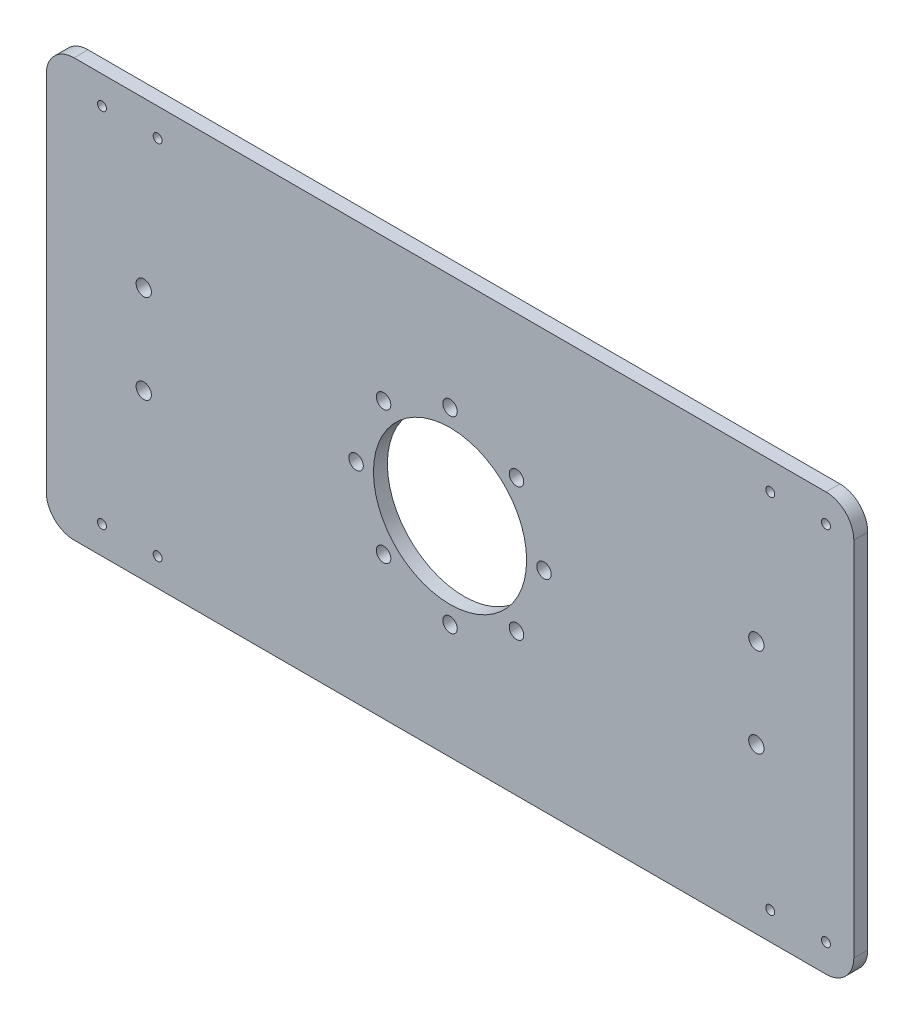
from build123d import *

# Parameters (mm, degrees)
SKETCH_1_W          = 290
SKETCH_1_H          = 150
EXTRUDE_1_DEPTH     = 5
CUT_EXTRUDE_2_REACH = 165.325
SKETCH_5_R          = 27.5
SKETCH_5_R_2        = 2.6
FILLET_1_R          = 10
SKETCH_6_R          = 2.75
CUT_EXTRUDE_3_DEPTH = 10
SKETCH_7_R          = 1.6
CUT_EXTRUDE_4_DEPTH = 10


with BuildPart() as part:
    # 草图1 → 凸台-拉伸1 (new body)
    with BuildSketch(Plane.XY):
        Rectangle(SKETCH_1_W, SKETCH_1_H)
    extrude(amount=EXTRUDE_1_DEPTH)

    # 草图5 → 切除-拉伸2 (cut, up to next)
    with BuildSketch(Plane(origin=(0, 0, 0), x_dir=(-1, 0, 0), z_dir=(0, 0, -1)), mode=Mode.PRIVATE) as cut_extrude_2_sk1:
        Circle(SKETCH_5_R)
    cut_extrude_2_tool1 = extrude(cut_extrude_2_sk1.sketch, amount=-CUT_EXTRUDE_2_REACH, mode=Mode.PRIVATE) & part.part
    # 草图5 → 切除-拉伸2 (cut, up to next)
    with BuildSketch(Plane(origin=(0, 0, 0), x_dir=(-1, 0, 0), z_dir=(0, 0, -1)), mode=Mode.PRIVATE) as cut_extrude_2_sk2:
        with Locations((23.864853865, 23.864853865)):
            Circle(SKETCH_5_R_2)
    cut_extrude_2_tool2 = extrude(cut_extrude_2_sk2.sketch, amount=-CUT_EXTRUDE_2_REACH, mode=Mode.PRIVATE) & part.part
    # 草图5 → 切除-拉伸2 (cut, up to next)
    with BuildSketch(Plane(origin=(0, 0, 0), x_dir=(-1, 0, 0), z_dir=(0, 0, -1)), mode=Mode.PRIVATE) as cut_extrude_2_sk3:
        with Locations((0, 33.75)):
            Circle(SKETCH_5_R_2)
    cut_extrude_2_tool3 = extrude(cut_extrude_2_sk3.sketch, amount=-CUT_EXTRUDE_2_REACH, mode=Mode.PRIVATE) & part.part
    # 草图5 → 切除-拉伸2 (cut, up to next)
    with BuildSketch(Plane(origin=(0, 0, 0), x_dir=(-1, 0, 0), z_dir=(0, 0, -1)), mode=Mode.PRIVATE) as cut_extrude_2_sk4:
        with Locations((-23.864853865, 23.864853865)):
            Circle(SKETCH_5_R_2)
    cut_extrude_2_tool4 = extrude(cut_extrude_2_sk4.sketch, amount=-CUT_EXTRUDE_2_REACH, mode=Mode.PRIVATE) & part.part
    # 草图5 → 切除-拉伸2 (cut, up to next)
    with BuildSketch(Plane(origin=(0, 0, 0), x_dir=(-1, 0, 0), z_dir=(0, 0, -1)), mode=Mode.PRIVATE) as cut_extrude_2_sk5:
        with Locations((-33.75, 0)):
            Circle(SKETCH_5_R_2)
    cut_extrude_2_tool5 = extrude(cut_extrude_2_sk5.sketch, amount=-CUT_EXTRUDE_2_REACH, mode=Mode.PRIVATE) & part.part
    # 草图5 → 切除-拉伸2 (cut, up to next)
    with BuildSketch(Plane(origin=(0, 0, 0), x_dir=(-1, 0, 0), z_dir=(0, 0, -1)), mode=Mode.PRIVATE) as cut_extrude_2_sk6:
        with Locations((-23.864853865, -23.864853865)):
            Circle(SKETCH_5_R_2)
    cut_extrude_2_tool6 = extrude(cut_extrude_2_sk6.sketch, amount=-CUT_EXTRUDE_2_REACH, mode=Mode.PRIVATE) & part.part
    # 草图5 → 切除-拉伸2 (cut, up to next)
    with BuildSketch(Plane(origin=(0, 0, 0), x_dir=(-1, 0, 0), z_dir=(0, 0, -1)), mode=Mode.PRIVATE) as cut_extrude_2_sk7:
        with Locations((0, -33.75)):
            Circle(SKETCH_5_R_2)
    cut_extrude_2_tool7 = extrude(cut_extrude_2_sk7.sketch, amount=-CUT_EXTRUDE_2_REACH, mode=Mode.PRIVATE) & part.part
    # 草图5 → 切除-拉伸2 (cut, up to next)
    with BuildSketch(Plane(origin=(0, 0, 0), x_dir=(-1, 0, 0), z_dir=(0, 0, -1)), mode=Mode.PRIVATE) as cut_extrude_2_sk8:
        with Locations((23.864853865, -23.864853865)):
            Circle(SKETCH_5_R_2)
    cut_extrude_2_tool8 = extrude(cut_extrude_2_sk8.sketch, amount=-CUT_EXTRUDE_2_REACH, mode=Mode.PRIVATE) & part.part
    # 草图5 → 切除-拉伸2 (cut, up to next)
    with BuildSketch(Plane(origin=(0, 0, 0), x_dir=(-1, 0, 0), z_dir=(0, 0, -1)), mode=Mode.PRIVATE) as cut_extrude_2_sk9:
        with Locations((33.75, 0)):
            Circle(SKETCH_5_R_2)
    cut_extrude_2_tool9 = extrude(cut_extrude_2_sk9.sketch, amount=-CUT_EXTRUDE_2_REACH, mode=Mode.PRIVATE) & part.part
    add(cut_extrude_2_tool1.solids().sort_by_distance((0, 0, 0))[0], mode=Mode.SUBTRACT)
    add(cut_extrude_2_tool2.solids().sort_by_distance((-23.864854, 23.864854, 0))[0], mode=Mode.SUBTRACT)
    add(cut_extrude_2_tool3.solids().sort_by_distance((0, 33.75, 0))[0], mode=Mode.SUBTRACT)
    add(cut_extrude_2_tool4.solids().sort_by_distance((23.864854, 23.864854, 0))[0], mode=Mode.SUBTRACT)
    add(cut_extrude_2_tool5.solids().sort_by_distance((33.75, 0, 0))[0], mode=Mode.SUBTRACT)
    add(cut_extrude_2_tool6.solids().sort_by_distance((23.864854, -23.864854, 0))[0], mode=Mode.SUBTRACT)
    add(cut_extrude_2_tool7.solids().sort_by_distance((0, -33.75, 0))[0], mode=Mode.SUBTRACT)
    add(cut_extrude_2_tool8.solids().sort_by_distance((-23.864854, -23.864854, 0))[0], mode=Mode.SUBTRACT)
    add(cut_extrude_2_tool9.solids().sort_by_distance((-33.75, 0, 0))[0], mode=Mode.SUBTRACT)

    # 圆角1
    fillet_1_edges = [part.edges().sort_by_distance(p)[0] for p in [
        (145, 75, 2.5),
        (145, -75, 2.5),
        (-145, -75, 2.5),
        (-145, 75, 2.5),
    ]]
    fillet(fillet_1_edges, radius=FILLET_1_R)

    # 草图6 → 切除-拉伸3 (cut)
    with BuildSketch(Plane(origin=(0, 0, 0), x_dir=(-1, 0, 0), z_dir=(0, 0, -1))):
        with Locations((110, -16)):
            Circle(SKETCH_6_R)
        with Locations((-110, -16)):
            Circle(SKETCH_6_R)
        with Locations((-110, 16)):
            Circle(SKETCH_6_R)
        with Locations((110, 16)):
            Circle(SKETCH_6_R)
    extrude(amount=-CUT_EXTRUDE_3_DEPTH, mode=Mode.SUBTRACT)

    # 草图7 → 切除-拉伸4 (cut)
    with BuildSketch(Plane(origin=(0, 0, 0), x_dir=(-1, 0, 0), z_dir=(0, 0, -1))):
        with Locations((-135, 65)):
            Circle(SKETCH_7_R)
        with Locations((-115, 65)):
            Circle(SKETCH_7_R)
        with Locations((105, 65)):
            Circle(SKETCH_7_R)
        with Locations((125, 65)):
            Circle(SKETCH_7_R)
        with Locations((105, -65)):
            Circle(SKETCH_7_R)
        with Locations((125, -65)):
            Circle(SKETCH_7_R)
        with Locations((-135, -65)):
            Circle(SKETCH_7_R)
        with Locations((-115, -65)):
            Circle(SKETCH_7_R)
    extrude(amount=-CUT_EXTRUDE_4_DEPTH, mode=Mode.SUBTRACT)


solid = part.part
